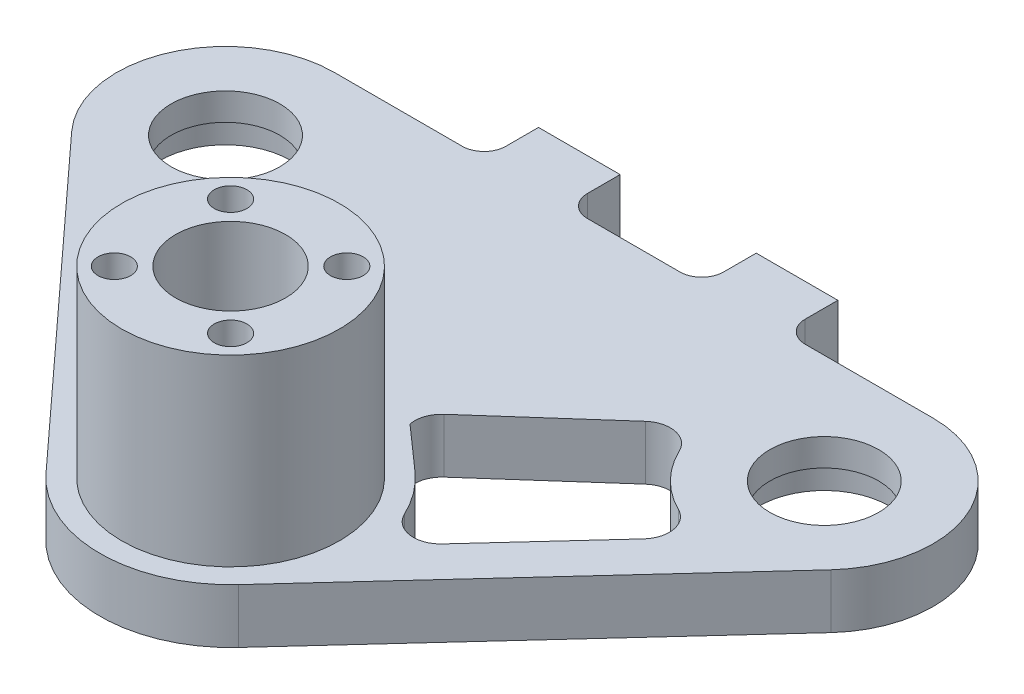
from build123d import *

# Parameters (mm, degrees)
SKETCH1_R              = 10.1
SKETCH1_R_2            = 10
MAIN_BODY_DEPTH        = 10
SKETCH2_R              = 12
BEARING_RECESS_DEPTH   = 5
STANDOFF_START         = 1.5
SKETCH3_R              = 21.5
SKETCH3_R_2            = 10.1
STANDOFF_SECTION_DEPTH = 1.5
SKETCH9_R              = 20
SKETCH9_R_2            = 10.1
BOSS_EXTRUDE1_DEPTH    = 33.7
EXTRA_GEOMETRY_DEPTH   = 10
SKETCH8_R              = 2
CUT_EXTRUDE1_DEPTH     = 6
SKETCH4_R              = 3
M6_BOLT_HOLES_DEPTH    = 122.389206984


with BuildPart() as part:
    # Sketch1 → Main Body (new body)
    with BuildSketch(Plane(origin=(0, 0, 0), x_dir=(1, 0, 0), z_dir=(0, 1, 0))):
        with BuildLine():
            Line((-69.741518057, 40.551033083), (-17.689821668, -16.219439242))
            ThreePointArc((-17.689821668, -16.219439242), (17.115072934, -16.824811395), (15.914514265, 17.96463848))
            Line((15.914514265, 17.96463848), (-41.737904779, 69.037764518))
            ThreePointArc((-41.737904779, 69.037764518), (-69.262560778, 68.087908614), (-69.741518057, 40.551033083))
        make_face()
        Circle(SKETCH1_R, mode=Mode.SUBTRACT)
        with Locations((-55, 54.067232452)):
            Circle(SKETCH1_R_2, mode=Mode.SUBTRACT)
        with BuildLine():
            Line((-47.625471592, 28.267691162), (-29.927098797, 8.964862385))
            ThreePointArc((-29.927098797, 8.964862385), (-25.488644513, 7.400949716), (-21.717284924, 10.215651499))
            ThreePointArc((-21.717284924, 10.215651499), (-17.115072934, 16.824811395), (-10.585592312, 21.539388))
            ThreePointArc((-10.585592312, 21.539388), (-7.835804554, 25.358336357), (-9.475400239, 29.769393516))
            Line((-9.475400239, 29.769393516), (-29.078104388, 47.135037426))
            ThreePointArc((-29.078104388, 47.135037426), (-33.398420323, 48.290403264), (-36.914902554, 45.527370018))
            ThreePointArc((-36.914902554, 45.527370018), (-40.737439222, 40.046556289), (-46.152073662, 36.130839294))
            ThreePointArc((-46.152073662, 36.130839294), (-48.85455966, 32.56761471), (-47.625471592, 28.267691162))
        make_face(mode=Mode.SUBTRACT)
    extrude(amount=MAIN_BODY_DEPTH)

    # Sketch2 → Bearing Recess (cut)
    with BuildSketch(Plane.XZ):
        with Locations((-55, -54.067232452)):
            Circle(SKETCH2_R)
    extrude(amount=-BEARING_RECESS_DEPTH, mode=Mode.SUBTRACT)

    # Sketch3 → Standoff Section (add)
    with BuildSketch(Plane.XZ.offset(STANDOFF_START)):
        Circle(SKETCH3_R)
        Circle(SKETCH3_R_2, mode=Mode.SUBTRACT)
    extrude(amount=-STANDOFF_SECTION_DEPTH)

    # Sketch9 → Boss-Extrude1 (add)
    with BuildSketch(Plane(origin=(0, 10, 0), x_dir=(1, 0, 0), z_dir=(0, 1, 0))):
        Circle(SKETCH9_R)
        Circle(SKETCH9_R_2, mode=Mode.SUBTRACT)
    extrude(amount=BOSS_EXTRUDE1_DEPTH)

    # Sketch6 → Extra Geometry (add)
    with BuildSketch(Plane(origin=(0, 0, 0), x_dir=(1, 0, 0), z_dir=(0, 1, 0))):
        with BuildLine():
            Line((0, 74.067232452), (0, 32.062988668))
            Line((0, 32.062988668), (-41.737904779, 69.037764518))
            ThreePointArc((-41.737904779, 69.037764518), (-47.908125823, 72.767642091), (-55, 74.067232452))
            Line((-55, 74.067232452), (-31.5, 74.067232452))
            ThreePointArc((-31.5, 74.067232452), (-28.671572875, 75.238805327), (-27.5, 78.067232452))
            Line((-27.5, 78.067232452), (-27.5, 84.067232452))
            Line((-27.5, 84.067232452), (-12.5, 84.067232452))
            Line((-12.5, 84.067232452), (-12.5, 78.067232452))
            ThreePointArc((-12.5, 78.067232452), (-11.328427125, 75.238805327), (-8.5, 74.067232452))
            Line((-8.5, 74.067232452), (0, 74.067232452))
        make_face()
    extrude(amount=EXTRA_GEOMETRY_DEPTH)

    # Sketch8 → Cut-Extrude1 (cut)
    with BuildSketch(Plane(origin=(0, 0, -84.067232452), x_dir=(-1, 0, 0), z_dir=(0, 0, -1))):
        with Locations((20, 5)):
            Circle(SKETCH8_R)
    extrude(amount=-CUT_EXTRUDE1_DEPTH, mode=Mode.SUBTRACT)

    # Mirror2: part across plane


with BuildPart() as part_1:
    add(part.part)
    add(part.part.mirror(Plane(origin=(0, 0, 0), x_dir=(0, 0, 1), z_dir=(1, 0, 0))))

    # Sketch4 → M6 Bolt holes (cut, through all)
    with BuildSketch(Plane.XZ.offset(1.5)):
        with Locations((-10.677312396, 10.677312396)):
            Circle(SKETCH4_R)
        with Locations((10.677312396, 10.677312396)):
            Circle(SKETCH4_R)
        with Locations((10.677312396, -10.677312396)):
            Circle(SKETCH4_R)
        with Locations((-10.677312396, -10.677312396)):
            Circle(SKETCH4_R)
    extrude(amount=-M6_BOLT_HOLES_DEPTH, mode=Mode.SUBTRACT)


solid = part_1.part
